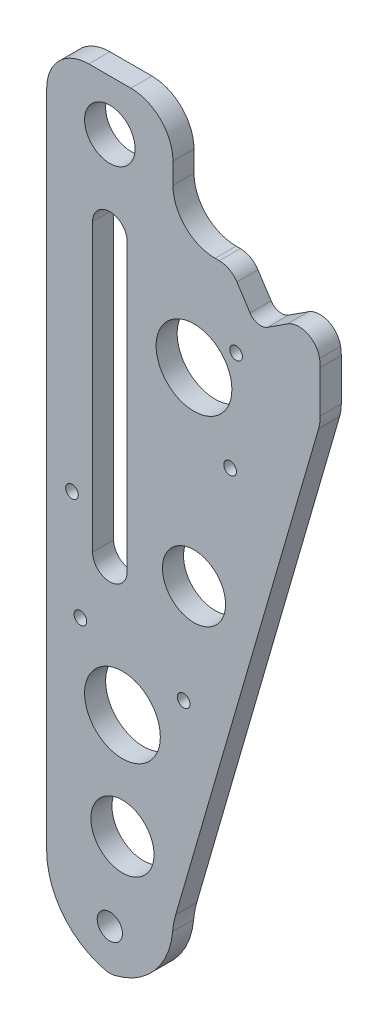
from build123d import *

# Parameters (mm, degrees)
SKETCH_1_W          = 30
SKETCH_1_H          = 185
EXTRUDE_1_DEPTH     = 5
SKETCH_2_R          = 6
SKETCH_2_R_2        = 3
CUT_EXTRUDE_1_DEPTH = 94.841621896
FILLET_1_R          = 10
SKETCH_5_W          = 35
SKETCH_5_H          = 30
EXTRUDE_3_DEPTH     = 5
FILLET_4_R          = 10
FILLET_5_R          = 18
CUT_EXTRUDE_3_DEPTH = 5
CUT_EXTRUDE_4_DEPTH = 5
EXTRUDE_START       = -5
EXTRUDE_5_DEPTH     = 5
SKETCH_11_R         = 1.5
CUT_EXTRUDE_5_DEPTH = 106.267516357
SKETCH_12_R         = 9
SKETCH_12_R_2       = 7.5
CUT_EXTRUDE_6_DEPTH = 106.267516357
CUT_EXTRUDE_7_DEPTH = 106.267516357
FILLET_9_R          = 5
FILLET_10_R         = 3
FILLET_11_R         = 5
FILLET_12_R         = 20


with BuildPart() as part:
    # 草图1 → 凸台-拉伸1 (new body)
    with BuildSketch(Plane.XY):
        Rectangle(SKETCH_1_W, SKETCH_1_H)
    extrude(amount=EXTRUDE_1_DEPTH)

    # 草图2 → 切除-拉伸1 (cut, through all)
    with BuildSketch(Plane.XY.offset(5)):
        with Locations((0, 80.5)):
            Circle(SKETCH_2_R)
        with Locations((0, -82.5)):
            Circle(SKETCH_2_R_2)
    extrude(amount=-CUT_EXTRUDE_1_DEPTH, mode=Mode.SUBTRACT)

    # 圆角1
    fillet_1_edges = [part.edges().sort_by_distance(p)[0] for p in [
        (-15, 92.5, 2.5),
        (15, 92.5, 2.5),
    ]]
    fillet(fillet_1_edges, radius=FILLET_1_R)

    # 草图5 → 凸台-拉伸3 (add)
    with BuildSketch(Plane.XY.offset(5)):
        with Locations((32.5, 52.5)):
            Rectangle(SKETCH_5_W, SKETCH_5_H)
    extrude(amount=-EXTRUDE_3_DEPTH)

    # 圆角4
    fillet_4_edges = [part.edges().sort_by_distance(p)[0] for p in [
        (15, 37.5, 2.5),
        (15, 67.5, 2.5),
        (50, 67.5, 2.5),
        (50, 37.5, 2.5),
    ]]
    fillet(fillet_4_edges, radius=FILLET_4_R)

    # 圆角5
    # the kernel refuses this fillet: 18 mm, written as the material it takes off along each edge
    with BuildSketch(Plane(origin=(-15, -92.5, -45), x_dir=(0, 1, 0), z_dir=(0, 0, 1)), Plane(origin=(15, -92.5, -45), x_dir=(-1, 0, 0), z_dir=(0, 0, 1))) as fillet_5_piece_1:
        with BuildLine():
            CenterArc((FILLET_5_R, -FILLET_5_R), FILLET_5_R, 90, 90)
            Line((0, -FILLET_5_R), (0, 0))
            Line((0, 0), (FILLET_5_R, 0))
        make_face()
    extrude(amount=95, mode=Mode.SUBTRACT)

    # 草图8 → 切除-拉伸3 (cut)
    with BuildSketch(Plane(origin=(0, 0, 0), x_dir=(-1, 0, 0), z_dir=(0, 0, -1))):
        with BuildLine():
            Line((-4.1, 60.5), (-4.1, -7.5))
            ThreePointArc((-4.1, -7.5), (0, -11.6), (4.1, -7.5))
            Line((4.1, -7.5), (4.1, 60.5))
            ThreePointArc((4.1, 60.5), (0, 64.6), (-4.1, 60.5))
        make_face()
    extrude(amount=-CUT_EXTRUDE_3_DEPTH, mode=Mode.SUBTRACT)

    # 草图9 → 切除-拉伸4 (cut)
    with BuildSketch(Plane.XY.offset(5)):
        Polygon((22.949354722, 80.050183125), (35, 61.5), (47.495924497, 69.617653207), align=None)
    extrude(amount=-CUT_EXTRUDE_4_DEPTH, mode=Mode.SUBTRACT)

    # 草图10 → 凸台-拉伸5 (add)
    with BuildSketch(Plane.XY.offset(5).offset(EXTRUDE_START)):
        with BuildLine():
            Line((25, 37.5), (40, 37.5))
            ThreePointArc((40, 37.5), (46.005154783, 39.503868684), (49.603601244, 44.712376794))
            Line((49.603601244, 44.712376794), (15, -74.5))
            Line((15, -74.5), (15, 27.5))
            ThreePointArc((15, 27.5), (17.928932188, 34.571067812), (25, 37.5))
        make_face()
    extrude(amount=EXTRUDE_5_DEPTH)

    # 草图11 → 切除-拉伸5 (cut, through all)
    with BuildSketch(Plane.XY.offset(5)):
        with Locations((-7, -22.5)):
            Circle(SKETCH_11_R)
        with Locations((17.544259481, -27.251770883)):
            Circle(SKETCH_11_R)
        with Locations((18.828850642, -7.5)):
            Circle(SKETCH_11_R)
        with Locations((28.585531862, 26.112604356)):
            Circle(SKETCH_11_R)
        with Locations((30, 50.5)):
            Circle(SKETCH_11_R)
        with Locations((-9, 2.5)):
            Circle(SKETCH_11_R)
    extrude(amount=-CUT_EXTRUDE_5_DEPTH, mode=Mode.SUBTRACT)

    # 草图12 → 切除-拉伸6 (cut, through all)
    with BuildSketch(Plane.XY.offset(5)):
        with Locations((20, 42.5)):
            Circle(SKETCH_12_R)
        with Locations((20, -2.5)):
            Circle(SKETCH_12_R_2)
        with Locations((3, -37.5)):
            Circle(SKETCH_12_R)
        with Locations((3, -62.5)):
            Circle(SKETCH_12_R_2)
    extrude(amount=-CUT_EXTRUDE_6_DEPTH, mode=Mode.SUBTRACT)

    # 草图13 → 切除-拉伸7 (cut, through all)
    with BuildSketch(Plane.XY.offset(5)):
        Polygon((22.804344395, 76.602108744), (34.957124842, 57.894703657), (54.492950931, 70.585646319), align=None)
    extrude(amount=-CUT_EXTRUDE_7_DEPTH, mode=Mode.SUBTRACT)

    # 圆角9
    fillet_9_edges = [part.edges().sort_by_distance(p)[0] for p in [
        (46.30180901, 65.264483447, 2.5),
        (28.717293233, 67.5, 2.5),
    ]]
    fillet(fillet_9_edges, radius=FILLET_9_R)

    # 圆角10
    fillet_10_edges = [part.edges().sort_by_distance(p)[0] for p in [
        (34.957124842, 57.894703657, 2.5),
    ]]
    fillet(fillet_10_edges, radius=FILLET_10_R)

    # 圆角11
    fillet_11_edges = [part.edges().sort_by_distance(p)[0] for p in [
        (0, -92.248239349, 2.5),
    ]]
    fillet(fillet_11_edges, radius=FILLET_11_R)

    # 圆角12
    fillet_12_edges = [part.edges().sort_by_distance(p)[0] for p in [
        (15, -74.5, 2.5),
    ]]
    fillet(fillet_12_edges, radius=FILLET_12_R)


solid = part.part
